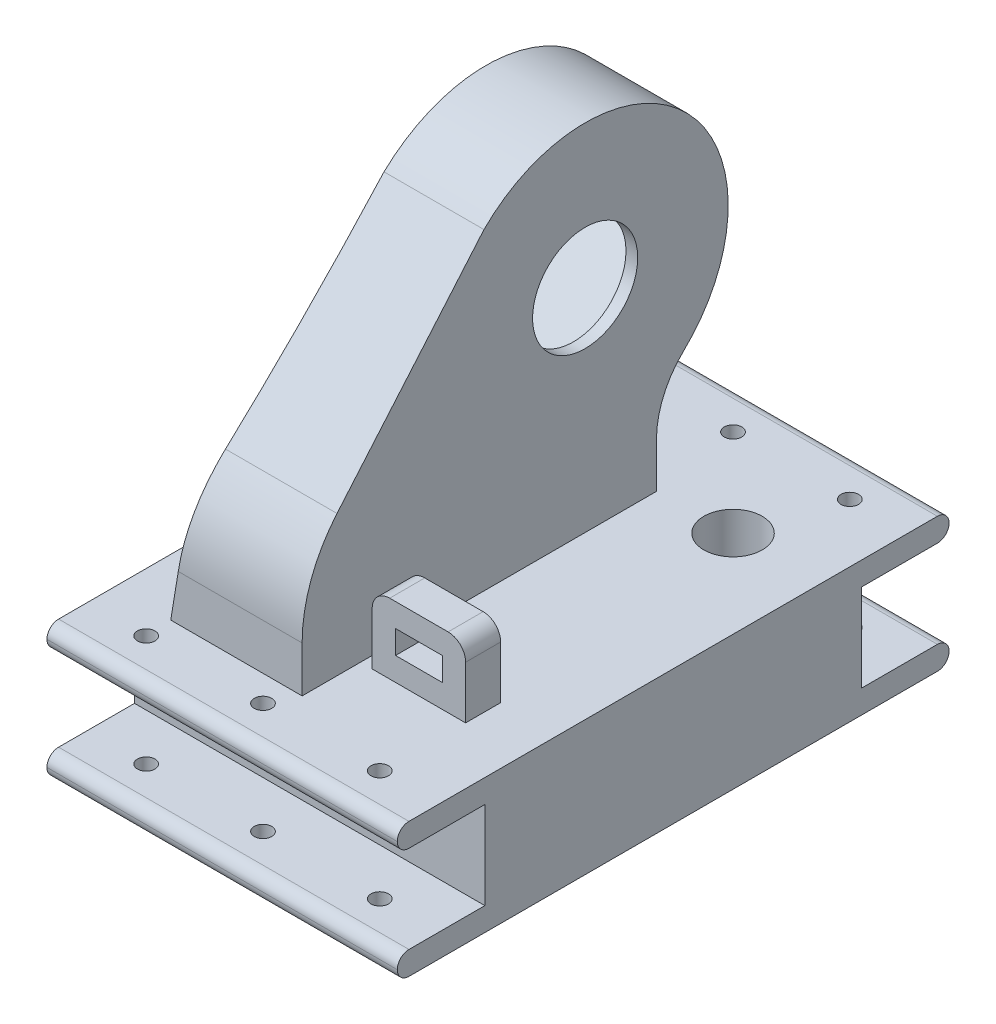
from build123d import *

# Parameters (mm, degrees)
SKETCH2_R                       = 48.5
BOSS_EXTRUDE1_DEPTH             = 4
BOSS_EXTRUDE2_DEPTH             = 14
CUT_EXTRUDE5_REACH              = 97.597
SKETCH9_R                       = 1.3
CUT_EXTRUDE6_DEPTH              = 7.5
CUT_EXTRUDE9_REACH              = 96.471
SKETCH11_R                      = 9
BOSS_EXTRUDE7_DEPTH             = 9
BOSS_EXTRUDE7_DIRECTION_2_REACH = 104.912
BOSS_EXTRUDE10_DEPTH            = 9
SKETCH27_W                      = 16
SKETCH27_H                      = 6
BOSS_EXTRUDE11_DEPTH            = 12
FILLET6_R                       = 3
CUT_EXTRUDE16_REACH             = 111.016
SKETCH28_W                      = 8
SKETCH28_H                      = 4
CUT_EXTRUDE17_DEPTH             = 95.342420983
CUT_EXTRUDE17_DEPTH_BACK        = 95.342420983
CUT_EXTRUDE18_DEPTH             = 4
BOSS_EXTRUDE12_DEPTH            = 4
BOSS_EXTRUDE13_DEPTH            = 60
FILLET7_R                       = 2
SKETCH34_R                      = 5
CUT_EXTRUDE19_DEPTH             = 86.792249968
SKETCH36_R                      = 1.5
CUT_EXTRUDE20_DEPTH             = 86.792249968


with BuildPart() as part:
    # Sketch2 → Boss-Extrude1 (new body)
    with BuildSketch(Plane(origin=(0, 0, 0), x_dir=(1, 0, 0), z_dir=(0, 1, 0))):
        with Locations(Location((0, 0, 0), (0, 0, 270))):
            Circle(SKETCH2_R)
    extrude(amount=BOSS_EXTRUDE1_DEPTH)

    # Sketch7 → Boss-Extrude2 (add)
    with BuildSketch(Plane(origin=(-4, 0, 0), x_dir=(0, 0, -1), z_dir=(1, 0, 0))):
        with BuildLine():
            Line((23.129947874, 4), (23.129947874, 11.644549616))
            ThreePointArc((23.129947874, 11.644549616), (24.589048403, 18.743749901), (28.729797284, 24.692011643))
            ThreePointArc((28.729797284, 24.692011643), (29.313383054, 55.284736897), (-1.284289494, 55.479275971))
            Line((-1.284289494, 55.479275971), (-27.227315747, 29.536249718))
            ThreePointArc((-27.227315747, 29.536249718), (-32.64663453, 21.425665997), (-34.549646217, 11.858580188))
            Line((-34.549646217, 11.858580188), (-34.549646217, 4))
            Line((-34.549646217, 4), (23.129947874, 4))
        make_face()
    extrude(amount=-BOSS_EXTRUDE2_DEPTH)

    # Sketch8 → Cut-Extrude5 (cut, up to next)
    with BuildSketch(Plane(origin=(-6, 0, 0), x_dir=(0, 0, -1), z_dir=(1, 0, 0)), mode=Mode.PRIVATE) as cut_extrude5_sk1:
        Polygon((-15.249648422, 25.957567857), (13.741729607, 54.948945886), (28.590972012, 40.099703481), (-0.400406017, 11.108325452), align=None)
    cut_extrude5_tool1 = extrude(cut_extrude5_sk1.sketch, amount=-CUT_EXTRUDE5_REACH, mode=Mode.PRIVATE) & part.part
    add(cut_extrude5_tool1.solids().sort_by_distance((-6, 33.028636, -6.670662))[0], mode=Mode.SUBTRACT)

    # Sketch9 → Cut-Extrude6 (cut)
    with BuildSketch(Plane.ZY.offset(18)):
        with Locations((-20.105690637, 53.534732323)):
            Circle(SKETCH9_R)
        with Locations((-27.176758449, 46.463664511)):
            Circle(SKETCH9_R)
        with Locations((6.764367048, 12.522539014)):
            Circle(SKETCH9_R)
        with Locations((13.83543486, 19.593606826)):
            Circle(SKETCH9_R)
    extrude(amount=-CUT_EXTRUDE6_DEPTH, mode=Mode.SUBTRACT)

    # Sketch11 → Cut-Extrude9 (cut, up to next)
    with BuildSketch(Plane(origin=(-4, 0, 0), x_dir=(0, 0, -1), z_dir=(1, 0, 0)), mode=Mode.PRIVATE) as cut_extrude9_sk1:
        with Locations((13.918506302, 40.276480176)):
            Circle(SKETCH11_R)
    cut_extrude9_tool1 = extrude(cut_extrude9_sk1.sketch, amount=-CUT_EXTRUDE9_REACH, mode=Mode.PRIVATE) & part.part
    add(cut_extrude9_tool1.solids().sort_by_distance((-4, 40.27648, -13.918506))[0], mode=Mode.SUBTRACT)

    # Sketch17 → Boss-Extrude7 (add)
    with BuildSketch(Plane.ZY.offset(18)):
        with BuildLine():
            ThreePointArc((34.549646217, 11.858580188), (33.008342843, 20.500891953), (28.574482006, 28.077569775))
            ThreePointArc((28.574482006, 28.077569775), (27.915386359, 28.820289685), (27.227315747, 29.536249718))
            Line((27.227315747, 29.536249718), (1.284289494, 55.479275971))
            Line((1.284289494, 55.479275971), (26.295003593, 26.127182305))
            ThreePointArc((26.295003593, 26.127182305), (30.194232218, 19.461281607), (31.549646217, 11.858580188))
            Line((31.549646217, 11.858580188), (31.549646217, 4))
            Line((31.549646217, 4), (34.549646217, 4))
            Line((34.549646217, 4), (34.549646217, 11.858580188))
        make_face()
        with BuildLine():
            Line((28.574482006, 28.077569775), (3.405609837, 57.600596315))
            ThreePointArc((3.405609837, 57.600596315), (-31.461505391, 57.378912253), (-30.796489049, 22.517434639))
            ThreePointArc((-30.796489049, 22.517434639), (-27.345864981, 17.560549854), (-26.129947874, 11.644549616))
            Line((-26.129947874, 11.644549616), (-26.129947874, 4))
            Line((-26.129947874, 4), (-23.129947874, 4))
            Line((-23.129947874, 4), (-23.129947874, 11.644549616))
            ThreePointArc((-23.129947874, 11.644549616), (-24.589048403, 18.743749901), (-28.729797284, 24.692011643))
            ThreePointArc((-28.729797284, 24.692011643), (-29.313383054, 55.284736897), (1.284289494, 55.479275971))
            Line((1.284289494, 55.479275971), (27.227315747, 29.536249718))
            ThreePointArc((27.227315747, 29.536249718), (27.915386359, 28.820289685), (28.574482006, 28.077569775))
        make_face()
    extrude(amount=BOSS_EXTRUDE7_DEPTH)

    # Boss-Extrude7 direction 2: up to this face of the body (flat: up to its plane)
    boss_extrude7_direction_2_end = Plane(part.part.faces().sort_by_distance((-4, 28.276431801, -1.649713195))[0])
    # Sketch17 → Boss-Extrude7 direction 2 (add, up to the picked face)
    with BuildSketch(Plane.ZY.offset(18), mode=Mode.PRIVATE) as boss_extrude7_direction_2_sk1:
        with BuildLine():
            ThreePointArc((34.549646217, 11.858580188), (33.008342843, 20.500891953), (28.574482006, 28.077569775))
            ThreePointArc((28.574482006, 28.077569775), (27.915386359, 28.820289685), (27.227315747, 29.536249718))
            Line((27.227315747, 29.536249718), (1.284289494, 55.479275971))
            Line((1.284289494, 55.479275971), (26.295003593, 26.127182305))
            ThreePointArc((26.295003593, 26.127182305), (30.194232218, 19.461281607), (31.549646217, 11.858580188))
            Line((31.549646217, 11.858580188), (31.549646217, 4))
            Line((31.549646217, 4), (34.549646217, 4))
            Line((34.549646217, 4), (34.549646217, 11.858580188))
        make_face()
    boss_extrude7_direction_2_tool1 = split(extrude(boss_extrude7_direction_2_sk1.sketch, amount=-BOSS_EXTRUDE7_DIRECTION_2_REACH, mode=Mode.PRIVATE), bisect_by=boss_extrude7_direction_2_end, keep=Keep.BOTH, mode=Mode.PRIVATE)
    # Sketch17 → Boss-Extrude7 direction 2 (add, up to the picked face)
    with BuildSketch(Plane.ZY.offset(18), mode=Mode.PRIVATE) as boss_extrude7_direction_2_sk2:
        with BuildLine():
            Line((28.574482006, 28.077569775), (3.405609837, 57.600596315))
            ThreePointArc((3.405609837, 57.600596315), (-31.461505391, 57.378912253), (-30.796489049, 22.517434639))
            ThreePointArc((-30.796489049, 22.517434639), (-27.345864981, 17.560549854), (-26.129947874, 11.644549616))
            Line((-26.129947874, 11.644549616), (-26.129947874, 4))
            Line((-26.129947874, 4), (-23.129947874, 4))
            Line((-23.129947874, 4), (-23.129947874, 11.644549616))
            ThreePointArc((-23.129947874, 11.644549616), (-24.589048403, 18.743749901), (-28.729797284, 24.692011643))
            ThreePointArc((-28.729797284, 24.692011643), (-29.313383054, 55.284736897), (1.284289494, 55.479275971))
            Line((1.284289494, 55.479275971), (27.227315747, 29.536249718))
            ThreePointArc((27.227315747, 29.536249718), (27.915386359, 28.820289685), (28.574482006, 28.077569775))
        make_face()
    boss_extrude7_direction_2_tool2 = split(extrude(boss_extrude7_direction_2_sk2.sketch, amount=-BOSS_EXTRUDE7_DIRECTION_2_REACH, mode=Mode.PRIVATE), bisect_by=boss_extrude7_direction_2_end, keep=Keep.BOTH, mode=Mode.PRIVATE)
    add(boss_extrude7_direction_2_tool1.solids().sort_by(Axis((-18, 4.612919, 33.049646), (1, 0, 0)))[0])
    add(boss_extrude7_direction_2_tool2.solids().sort_by(Axis((-18, 43.147366, 14.895406), (1, 0, 0)))[0])

    # Sketch25 → Boss-Extrude10 (add)
    with BuildSketch(Plane.ZY.offset(18)):
        with BuildLine():
            ThreePointArc((-28.729797284, 24.692011643), (-24.589048403, 18.743749901), (-23.129947874, 11.644549616))
            Line((-23.129947874, 11.644549616), (-23.129947874, 4))
            Line((-23.129947874, 4), (-15.129947874, 4))
            add(Edge.make_bspline(
                [(-28.729797284, 24.692011643), (-21.954867515, 18.253200081), (-19.09405247, 12.798017691), (-15.129947874, 4)],
                knots=[0, 0, 0, 0, 1, 1, 1, 1], degree=3))
        make_face()
        with BuildLine():
            add(Edge.make_bspline(
                [(11.751744758, 43.194871529), (26.551331141, 25.826361218), (25.549646217, 4)],
                knots=[0, 0, 0, 1, 1, 1], degree=2))
            Line((25.549646217, 4), (31.549646217, 4))
            Line((31.549646217, 4), (31.549646217, 11.858580188))
            ThreePointArc((31.549646217, 11.858580188), (30.194232218, 19.461281607), (26.295003593, 26.127182305))
            Line((26.295003593, 26.127182305), (11.751744758, 43.194871529))
        make_face()
    extrude(amount=BOSS_EXTRUDE10_DEPTH)

    # Sketch27 → Boss-Extrude11 (add)
    with BuildSketch(Plane(origin=(0, 4, 0), x_dir=(1, 0, 0), z_dir=(0, 1, 0))):
        with Locations((6, -21.549646217)):
            Rectangle(SKETCH27_W, SKETCH27_H)
    extrude(amount=BOSS_EXTRUDE11_DEPTH)

    # Fillet6
    fillet6_edges = [part.edges().sort_by_distance(p)[0] for p in [
        (-2, 16, 21.549646217),
        (14, 16, 21.549646217),
    ]]
    fillet(fillet6_edges, radius=FILLET6_R)

    # Sketch28 → Cut-Extrude16 (cut, up to next)
    with BuildSketch(Plane.XY.offset(24.549646217), mode=Mode.PRIVATE) as cut_extrude16_sk1:
        with Locations((6, 10)):
            Rectangle(SKETCH28_W, SKETCH28_H)
    cut_extrude16_tool1 = extrude(cut_extrude16_sk1.sketch, amount=-CUT_EXTRUDE16_REACH, mode=Mode.PRIVATE) & part.part
    add(cut_extrude16_tool1.solids().sort_by_distance((6, 10, 24.549646))[0], mode=Mode.SUBTRACT)

    # Sketch29 → Cut-Extrude17 (cut, two sides: drawn at the far end of the back side and taken through both)
    with BuildSketch(Plane.XY.offset(-CUT_EXTRUDE17_DEPTH_BACK)):
        with BuildLine():
            Line((-21, 64.776480176), (-27, 64.776480176))
            Line((-27, 64.776480176), (-27, 4))
            Line((-27, 4), (-26.5, 4))
            add(Edge.make_bspline(
                [(-21, 64.776480176), (-21.220459696, 34.140901434), (-26.5, 4)],
                knots=[0, 0, 0, 1, 1, 1], degree=2))
        make_face()
    extrude(amount=CUT_EXTRUDE17_DEPTH + CUT_EXTRUDE17_DEPTH_BACK, mode=Mode.SUBTRACT)

    # Sketch30 → Cut-Extrude18 (cut)
    with BuildSketch(Plane(origin=(0, 0, 0), x_dir=(1, 0, 0), z_dir=(0, 1, 0))):
        with BuildLine():
            Line((-36.252994357, 32.217548015), (-36.252994357, -32.217548015))
            ThreePointArc((-36.252994357, -32.217548015), (-48.5, 0), (-36.252994357, 32.217548015))
        make_face()
        with BuildLine():
            Line((-15.370426149, -46), (15.370426149, -46))
            ThreePointArc((15.370426149, -46), (0, -48.5), (-15.370426149, -46))
        make_face()
        with BuildLine():
            Line((23.747005643, 42.288647685), (23.747005643, -42.288647685))
            ThreePointArc((23.747005643, -42.288647685), (48.5, 0), (23.747005643, 42.288647685))
        make_face()
    extrude(amount=CUT_EXTRUDE18_DEPTH, mode=Mode.SUBTRACT)

    # Sketch33 → Boss-Extrude12 (add)
    with BuildSketch(Plane.XZ):
        Polygon((0, -48.5), (23.747005643, -48.5), (23.747005643, -42.288647685), (23.747005643, 42.288647685), (23.747005643, 46), (15.370426149, 46), (-15.370426149, 46), (-36.252994357, 46), (-36.252994357, 32.217548015), (-36.252994357, -32.217548015), (-36.252994357, -48.5), align=None)
    extrude(amount=-BOSS_EXTRUDE12_DEPTH)

    # Sketch35 → Boss-Extrude13 (add)
    with BuildSketch(Plane(origin=(23.747005643, 0, 0), x_dir=(0, 0, -1), z_dir=(1, 0, 0))):
        Polygon((48.5, -15), (48.5, -19), (-46, -19), (-46, -15), (-31, -15), (-31, 0), (-46, 0), (-46, 4), (48.5, 4), (48.5, 0), (33.5, 0), (33.5, -15), align=None)
    extrude(amount=-BOSS_EXTRUDE13_DEPTH)

    # Fillet7
    fillet7_edges = [part.edges().sort_by_distance(p)[0] for p in [
        (-6.252994357, 0, 46),
        (-6.252994357, 4, 46),
        (-6.252994357, 4, -48.5),
        (-6.252994357, 0, -48.5),
        (-6.252994357, -15, 46),
        (-6.252994357, -19, 46),
        (-6.252994357, -19, -48.5),
        (-6.252994357, -15, -48.5),
    ]]
    fillet(fillet7_edges, radius=FILLET7_R - 0.0001)  # a hair under: the kernel refuses the full size

    # Sketch34 → Cut-Extrude19 (cut, through all)
    with BuildSketch(Plane(origin=(0, 4, 0), x_dir=(1, 0, 0), z_dir=(0, 1, 0))):
        with Locations(Location((8.747005643, 26.5, 0), (0, 0, 270))):
            Circle(SKETCH34_R)
    extrude(amount=-CUT_EXTRUDE19_DEPTH, mode=Mode.SUBTRACT)

    # Sketch36 → Cut-Extrude20 (cut, through all)
    with BuildSketch(Plane(origin=(0, 4, 0), x_dir=(1, 0, 0), z_dir=(0, 1, 0))):
        with Locations(Location((-6.252994357, 41.5, 0), (0, 0, 270))):
            Circle(SKETCH36_R)
        with Locations(Location((13.747005643, 41.5, 0), (0, 0, 270))):
            Circle(SKETCH36_R)
        with Locations(Location((-26.252994357, 41.5, 0), (0, 0, 270))):
            Circle(SKETCH36_R)
        with Locations(Location((-26.252994357, -39, 0), (0, 0, 270))):
            Circle(SKETCH36_R)
        with Locations(Location((-6.252994357, -39, 0), (0, 0, 270))):
            Circle(SKETCH36_R)
        with Locations(Location((13.747005643, -39, 0), (0, 0, 270))):
            Circle(SKETCH36_R)
    extrude(amount=-CUT_EXTRUDE20_DEPTH, mode=Mode.SUBTRACT)


solid = part.part
